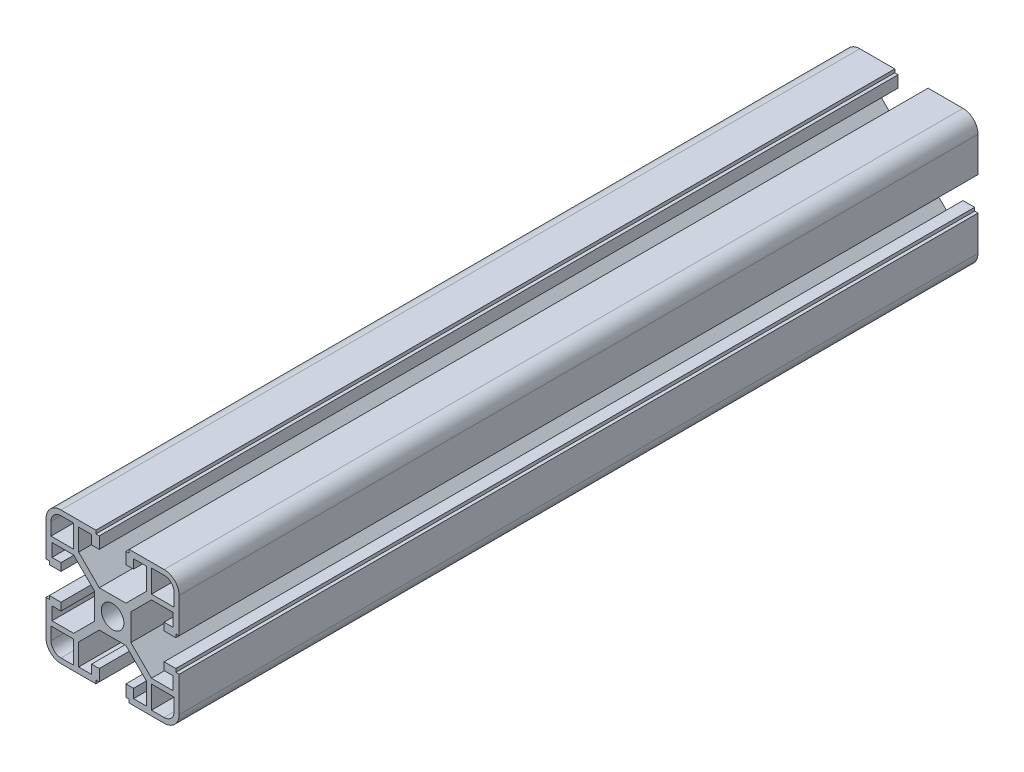
from build123d import *
from build123d.topology import SkipClean

# Parameters (mm, degrees)
BOSS_EXTRUDE1_DEPTH  = 240
MIRROR3_COPY_1_DEPTH = 240
MIRROR3_COPY_2_DEPTH = 240


with BuildPart() as part:
    # Sketch1 → Boss-Extrude1 (new body)
    with BuildSketch(Plane.XY):
        with BuildLine():
            Line((3.4, 0), (5.5, 0))
            Line((5.5, 0), (5.5, 4))
            Line((5.5, 4), (11.69, 10.19))
            Line((11.69, 10.19), (18.2, 10.19))
            Line((18.2, 10.19), (18.2, 6.3))
            Line((18.2, 6.3), (15.5, 6.3))
            Line((15.5, 6.3), (15.5, 4))
            Line((15.5, 4), (19, 4))
            Line((19, 4), (19, 5))
            Line((19, 5), (20, 5))
            Line((20, 5), (20, 15.5))
            ThreePointArc((20, 15.5), (18.681980515, 18.681980515), (15.5, 20))
            Line((15.5, 20), (5, 20))
            Line((5, 20), (5, 19))
            Line((5, 19), (4, 19))
            Line((4, 19), (4, 15.5))
            Line((4, 15.5), (6.3, 15.5))
            Line((6.3, 15.5), (6.3, 18.2))
            Line((6.3, 18.2), (10.19, 18.2))
            Line((10.19, 18.2), (10.19, 11.69))
            Line((10.19, 11.69), (4, 5.5))
            Line((4, 5.5), (0, 5.5))
            Line((0, 5.5), (0, 3.4))
            ThreePointArc((0, 3.4), (2.404163056, 2.404163056), (3.4, 0))
        make_face()
        with BuildLine():
            Line((18.5, 11.69), (18.5, 15.5))
            ThreePointArc((18.5, 15.5), (17.621320344, 17.621320344), (15.5, 18.5))
            Line((15.5, 18.5), (11.69, 18.5))
            Line((11.69, 18.5), (11.69, 11.69))
            Line((11.69, 11.69), (18.5, 11.69))
        make_face(mode=Mode.SUBTRACT)
    boss_extrude1 = extrude(amount=BOSS_EXTRUDE1_DEPTH)

    # Mirror1: Boss-Extrude1 across plane
    add(boss_extrude1.mirror(Plane.ZX))

    # Mirror2: Boss-Extrude1 across plane
    add(boss_extrude1.mirror(Plane(origin=(0, 0, 0), x_dir=(0, 0, 1), z_dir=(1, 0, 0))))

    # Mirror3 copy 1 sketch → Mirror3 copy 1 (add)
    with BuildSketch(Plane(origin=(0, 0, 0), x_dir=(-1, 0, 0), z_dir=(0, 0, 1))):
        with BuildLine():
            Line((3.4, 0), (5.5, 0))
            Line((5.5, 0), (5.5, 4))
            Line((5.5, 4), (11.69, 10.19))
            Line((11.69, 10.19), (18.2, 10.19))
            Line((18.2, 10.19), (18.2, 6.3))
            Line((18.2, 6.3), (15.5, 6.3))
            Line((15.5, 6.3), (15.5, 4))
            Line((15.5, 4), (19, 4))
            Line((19, 4), (19, 5))
            Line((19, 5), (20, 5))
            Line((20, 5), (20, 15.5))
            ThreePointArc((20, 15.5), (18.681980515, 18.681980515), (15.5, 20))
            Line((15.5, 20), (5, 20))
            Line((5, 20), (5, 19))
            Line((5, 19), (4, 19))
            Line((4, 19), (4, 15.5))
            Line((4, 15.5), (6.3, 15.5))
            Line((6.3, 15.5), (6.3, 18.2))
            Line((6.3, 18.2), (10.19, 18.2))
            Line((10.19, 18.2), (10.19, 11.69))
            Line((10.19, 11.69), (4, 5.5))
            Line((4, 5.5), (0, 5.5))
            Line((0, 5.5), (0, 3.4))
            ThreePointArc((0, 3.4), (2.404163056, 2.404163056), (3.4, 0))
        make_face()
        with BuildLine():
            Line((18.5, 11.69), (18.5, 15.5))
            ThreePointArc((18.5, 15.5), (17.621320344, 17.621320344), (15.5, 18.5))
            Line((15.5, 18.5), (11.69, 18.5))
            Line((11.69, 18.5), (11.69, 11.69))
            Line((11.69, 11.69), (18.5, 11.69))
        make_face(mode=Mode.SUBTRACT)
    extrude(amount=MIRROR3_COPY_1_DEPTH)

    # Mirror3 copy 2 sketch → Mirror3 copy 2 (add)
    with SkipClean():  # the faces are left unmerged after this step: merging them gives an invalid solid
        with BuildSketch(Plane.XY):
            with BuildLine():
                Line((3.4, 0), (5.5, 0))
                Line((5.5, 0), (5.5, -4))
                Line((5.5, -4), (11.69, -10.19))
                Line((11.69, -10.19), (18.2, -10.19))
                Line((18.2, -10.19), (18.2, -6.3))
                Line((18.2, -6.3), (15.5, -6.3))
                Line((15.5, -6.3), (15.5, -4))
                Line((15.5, -4), (19, -4))
                Line((19, -4), (19, -5))
                Line((19, -5), (20, -5))
                Line((20, -5), (20, -15.5))
                ThreePointArc((20, -15.5), (18.681980515, -18.681980515), (15.5, -20))
                Line((15.5, -20), (5, -20))
                Line((5, -20), (5, -19))
                Line((5, -19), (4, -19))
                Line((4, -19), (4, -15.5))
                Line((4, -15.5), (6.3, -15.5))
                Line((6.3, -15.5), (6.3, -18.2))
                Line((6.3, -18.2), (10.19, -18.2))
                Line((10.19, -18.2), (10.19, -11.69))
                Line((10.19, -11.69), (4, -5.5))
                Line((4, -5.5), (0, -5.5))
                Line((0, -5.5), (0, -3.4))
                ThreePointArc((0, -3.4), (2.404163056, -2.404163056), (3.4, 0))
            make_face()
            with BuildLine():
                Line((18.5, -11.69), (18.5, -15.5))
                ThreePointArc((18.5, -15.5), (17.621320344, -17.621320344), (15.5, -18.5))
                Line((15.5, -18.5), (11.69, -18.5))
                Line((11.69, -18.5), (11.69, -11.69))
                Line((11.69, -11.69), (18.5, -11.69))
            make_face(mode=Mode.SUBTRACT)
        extrude(amount=MIRROR3_COPY_2_DEPTH)


solid = part.part
